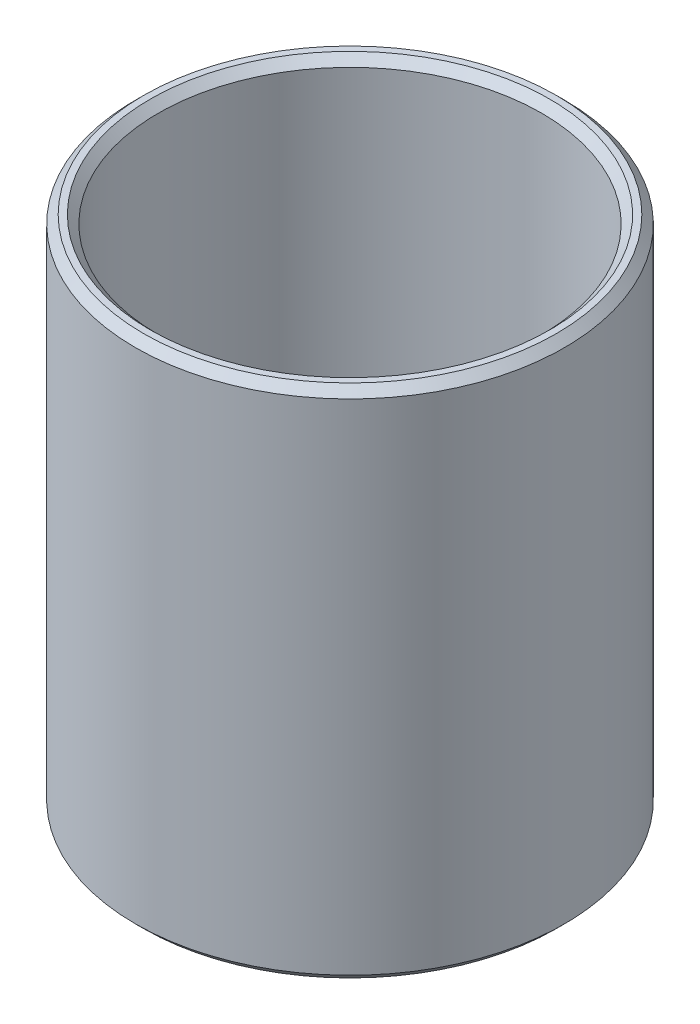
from build123d import *

# Parameters (mm, degrees)
SKETCH1_R           = 42.5
BOSS_EXTRUDE1_DEPTH = 102.103853451
SKETCH2_R           = 37.992938241
CUT_EXTRUDE1_DEPTH  = 119.480787006
CHAMFER1_SIZE       = 1.607444369


with BuildPart() as part:
    # Sketch1 → Boss-Extrude1 (new body)
    with BuildSketch(Plane(origin=(0, 0, 0), x_dir=(1, 0, 0), z_dir=(0, 1, 0))):
        Circle(SKETCH1_R)
    extrude(amount=BOSS_EXTRUDE1_DEPTH)

    # Sketch2 → Cut-Extrude1 (cut, through all)
    with BuildSketch(Plane(origin=(0, 0, 0), x_dir=(1, 0, 0), z_dir=(0, 1, 0))):
        Circle(SKETCH2_R)
    extrude(amount=CUT_EXTRUDE1_DEPTH, mode=Mode.SUBTRACT)

    # Chamfer1
    chamfer1_edges = [part.edges().sort_by_distance(p)[0] for p in [
        (-37.992938241, 102.103853451, 0),
        (-37.992938241, 0, 0),
        (-42.5, 0, 0),
        (-42.5, 102.103853451, 0),
    ]]
    chamfer(chamfer1_edges, length=CHAMFER1_SIZE)


solid = part.part
